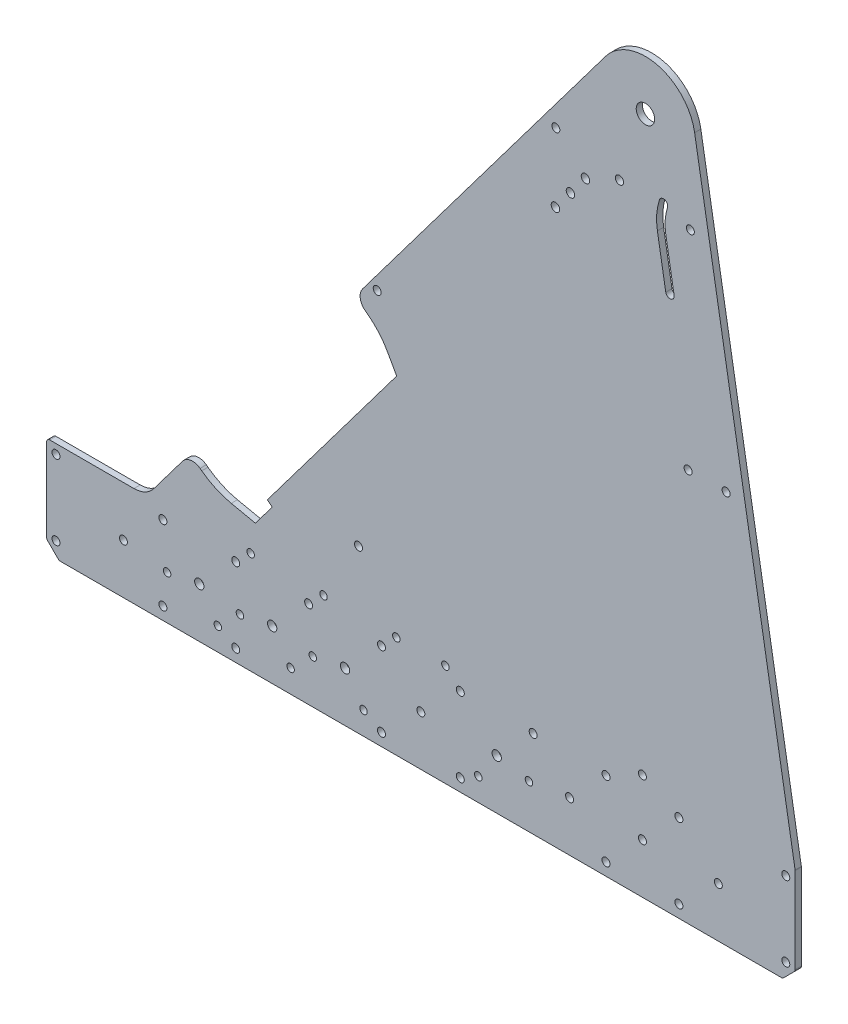
from build123d import *

# Parameters (mm, degrees)
BOSS_EXTRUDE1_DEPTH = 3.175
CUT_EXTRUDE1_REACH  = 534.132
SKETCH2_R           = 2.032
SKETCH5_R           = 2.032
SKETCH5_R_2         = 2.38125
CUT_EXTRUDE4_DEPTH  = 533.132273265
SKETCH6_R           = 2.032
CUT_EXTRUDE5_DEPTH  = 533.132273265
SKETCH3_R           = 4.699
SKETCH3_R_2         = 2.032
SKETCH3_R_3         = 2.0955
SKETCH3_R_4         = 2.159
CUT_EXTRUDE2_DEPTH  = 533.132273265
FILLET1_R           = 1.5875
CUT_EXTRUDE3_REACH  = 534.132
SKETCH4_R           = 1.905
FILLET2_R           = 38.1
FILLET3_R           = 6.35


with BuildPart() as part:
    # Sketch1 → Boss-Extrude1 (new body)
    with BuildSketch(Plane.XY):
        with BuildLine():
            Line((0, 0), (381, 0))
            Line((381, 0), (381, 50.8))
            Line((381, 50.8), (329.837432577, 350.351326687))
            ThreePointArc((329.837432577, 350.351326687), (310.787920632, 370.759100277), (284.504927721, 361.348180455))
            Line((284.504927721, 361.348180455), (157.027492501, 191.955579526))
            Line((157.027492501, 191.955579526), (169.711912675, 182.409841741))
            Line((169.711912675, 182.409841741), (178.167615548, 167.244965001))
            Line((178.167615548, 167.244965001), (112.326505112, 79.754995301))
            Line((112.326505112, 79.754995301), (114.863389147, 77.845847744))
            Line((114.863389147, 77.845847744), (106.272225141, 66.429869588))
            Line((106.272225141, 66.429869588), (85.709420174, 70.786944209))
            Line((85.709420174, 70.786944209), (73.025, 80.332681993))
            Line((73.025, 80.332681993), (54.610499914, 55.863409773))
            ThreePointArc((54.610499914, 55.863409773), (50.133294634, 52.136138511), (44.462963775, 50.8))
            Line((44.462963775, 50.8), (0, 50.8))
            Line((0, 50.8), (0, 0))
        make_face()
    extrude(amount=BOSS_EXTRUDE1_DEPTH)

    # Sketch2 → Cut-Extrude1 (cut, up to next)
    with BuildSketch(Plane.XY.offset(3.175), mode=Mode.PRIVATE) as cut_extrude1_sk1:
        with Locations((4.7625, 46.0375)):
            Circle(SKETCH2_R)
    cut_extrude1_tool1 = extrude(cut_extrude1_sk1.sketch, amount=-CUT_EXTRUDE1_REACH, mode=Mode.PRIVATE) & part.part
    # Sketch2 → Cut-Extrude1 (cut, up to next)
    with BuildSketch(Plane.XY.offset(3.175), mode=Mode.PRIVATE) as cut_extrude1_sk2:
        with Locations((4.7625, 7.9375)):
            Circle(SKETCH2_R)
    cut_extrude1_tool2 = extrude(cut_extrude1_sk2.sketch, amount=-CUT_EXTRUDE1_REACH, mode=Mode.PRIVATE) & part.part
    # Sketch2 → Cut-Extrude1 (cut, up to next)
    with BuildSketch(Plane.XY.offset(3.175), mode=Mode.PRIVATE) as cut_extrude1_sk3:
        with Locations((376.2375, 7.9375)):
            Circle(SKETCH2_R)
    cut_extrude1_tool3 = extrude(cut_extrude1_sk3.sketch, amount=-CUT_EXTRUDE1_REACH, mode=Mode.PRIVATE) & part.part
    # Sketch2 → Cut-Extrude1 (cut, up to next)
    with BuildSketch(Plane.XY.offset(3.175), mode=Mode.PRIVATE) as cut_extrude1_sk4:
        with Locations((376.2375, 46.0375)):
            Circle(SKETCH2_R)
    cut_extrude1_tool4 = extrude(cut_extrude1_sk4.sketch, amount=-CUT_EXTRUDE1_REACH, mode=Mode.PRIVATE) & part.part
    # Sketch2 → Cut-Extrude1 (cut, up to next)
    with BuildSketch(Plane.XY.offset(3.175), mode=Mode.PRIVATE) as cut_extrude1_sk5:
        Polygon((0, 6.35), (0, 0), (6.35, 0), align=None)
    cut_extrude1_tool5 = extrude(cut_extrude1_sk5.sketch, amount=-CUT_EXTRUDE1_REACH, mode=Mode.PRIVATE) & part.part
    # Sketch2 → Cut-Extrude1 (cut, up to next)
    with BuildSketch(Plane.XY.offset(3.175), mode=Mode.PRIVATE) as cut_extrude1_sk6:
        Polygon((381, 0), (374.65, 0), (381, 6.35), align=None)
    cut_extrude1_tool6 = extrude(cut_extrude1_sk6.sketch, amount=-CUT_EXTRUDE1_REACH, mode=Mode.PRIVATE) & part.part
    add(cut_extrude1_tool1.solids().sort_by_distance((4.7625, 46.0375, 3.175))[0], mode=Mode.SUBTRACT)
    add(cut_extrude1_tool2.solids().sort_by_distance((4.7625, 7.9375, 3.175))[0], mode=Mode.SUBTRACT)
    add(cut_extrude1_tool3.solids().sort_by_distance((376.2375, 7.9375, 3.175))[0], mode=Mode.SUBTRACT)
    add(cut_extrude1_tool4.solids().sort_by_distance((376.2375, 46.0375, 3.175))[0], mode=Mode.SUBTRACT)
    add(cut_extrude1_tool5.solids().sort_by_distance((2.116667, 2.116667, 3.175))[0], mode=Mode.SUBTRACT)
    add(cut_extrude1_tool6.solids().sort_by_distance((378.883333, 2.116667, 3.175))[0], mode=Mode.SUBTRACT)

    # Sketch5 → Cut-Extrude4 (cut, through all)
    with BuildSketch(Plane.XY.offset(3.175)):
        with Locations((39.116, 25.4)):
            Circle(SKETCH5_R)
        with Locations((59.182, 6.35)):
            Circle(SKETCH5_R)
        with Locations((59.182, 44.45)):
            Circle(SKETCH5_R)
        with Locations((96.266, 44.45)):
            Circle(SKETCH5_R)
        with Locations((133.35, 44.45)):
            Circle(SKETCH5_R)
        with Locations((170.434, 44.45)):
            Circle(SKETCH5_R)
        with Locations((210.566, 44.45)):
            Circle(SKETCH5_R)
        with Locations((210.566, 6.35)):
            Circle(SKETCH5_R)
        with Locations((170.434, 6.35)):
            Circle(SKETCH5_R)
        with Locations((247.65, 44.45)):
            Circle(SKETCH5_R)
        with Locations((266.192, 25.4)):
            Circle(SKETCH5_R)
        with Locations((77.724, 25.4)):
            Circle(SKETCH5_R_2)
        with Locations((114.808, 25.4)):
            Circle(SKETCH5_R_2)
        with Locations((151.892, 25.4)):
            Circle(SKETCH5_R_2)
        with Locations((229.108, 25.4)):
            Circle(SKETCH5_R_2)
        with Locations((190.5, 25.4)):
            Circle(SKETCH5_R)
        with Locations((303.276, 25.4)):
            Circle(SKETCH5_R)
        with Locations((341.884, 25.4)):
            Circle(SKETCH5_R)
    extrude(amount=-CUT_EXTRUDE4_DEPTH, mode=Mode.SUBTRACT)

    # Sketch6 → Cut-Extrude5 (cut, through all)
    with BuildSketch(Plane.XY.offset(3.175)):
        with Locations((284.734, 44.45)):
            Circle(SKETCH6_R)
        with Locations((284.734, 6.35)):
            Circle(SKETCH6_R)
        with Locations((321.818, 6.35)):
            Circle(SKETCH6_R)
        with Locations((321.818, 44.45)):
            Circle(SKETCH6_R)
        with Locations((96.266, 6.35)):
            Circle(SKETCH6_R)
        with Locations((303.276, 53.975)):
            Circle(SKETCH6_R)
    extrude(amount=-CUT_EXTRUDE5_DEPTH, mode=Mode.SUBTRACT)

    # Sketch3 → Cut-Extrude2 (cut, through all)
    with BuildSketch(Plane.XY.offset(3.175)):
        with Locations((304.8, 346.075)):
            Circle(SKETCH3_R)
        with Locations((168.275, 200.025)):
            Circle(SKETCH3_R_2)
        with Locations((158.75, 82.55)):
            Circle(SKETCH3_R_2)
        with Locations((291.577036885, 310.343175999)):
            Circle(SKETCH3_R_3)
        with Locations((274.268905915, 302.385091914)):
            Circle(SKETCH3_R_4)
        with Locations((266.632315687, 292.237555774)):
            Circle(SKETCH3_R_4)
        with Locations((258.99572546, 282.090019635)):
            Circle(SKETCH3_R_4)
        with Locations((327.675448038, 306.434088454)):
            Circle(SKETCH3_R_2)
        with Locations((345.849836456, 200.025)):
            Circle(SKETCH3_R_2)
        with Locations((259.211844923, 317.178274551)):
            Circle(SKETCH3_R_2)
        with Locations((326.523973131, 200.025)):
            Circle(SKETCH3_R_2)
        with BuildLine():
            Line((315.144293407, 272.686512232), (310.890297079, 297.59320296))
            ThreePointArc((310.890297079, 297.59320296), (310.545694803, 304.77018059), (311.933694664, 311.820089456))
            ThreePointArc((311.933694664, 311.820089456), (314.6561635, 313.20237938), (316.038453425, 310.479910544))
            ThreePointArc((316.038453425, 310.479910544), (314.852128757, 304.454347411), (315.146660617, 298.320178497))
            Line((315.146660617, 298.320178497), (319.400656945, 273.413487768))
            ThreePointArc((319.400656945, 273.413487768), (317.635962944, 270.921818231), (315.144293407, 272.686512232))
        make_face()
    extrude(amount=-CUT_EXTRUDE2_DEPTH, mode=Mode.SUBTRACT)

    # Fillet1
    fillet1_edges = [part.edges().sort_by_distance(p)[0] for p in [
        (374.65, 0, 1.5875),
        (381, 6.35, 1.5875),
        (381, 50.8, 1.5875),
        (6.35, 0, 1.5875),
        (0, 6.35, 1.5875),
        (0, 50.8, 1.5875),
    ]]
    fillet(fillet1_edges, radius=FILLET1_R)

    # Sketch4 → Cut-Extrude3 (cut, up to next)
    with BuildSketch(Plane(origin=(0, 0, 0), x_dir=(-1, 0, 0), z_dir=(0, 0, -1)), mode=Mode.PRIVATE) as cut_extrude3_sk1:
        with Locations((-61.318145625, 22.298133105)):
            Circle(SKETCH4_R)
    cut_extrude3_tool1 = extrude(cut_extrude3_sk1.sketch, amount=-CUT_EXTRUDE3_REACH, mode=Mode.PRIVATE) & part.part
    # Sketch4 → Cut-Extrude3 (cut, up to next)
    with BuildSketch(Plane(origin=(0, 0, 0), x_dir=(-1, 0, 0), z_dir=(0, 0, -1)), mode=Mode.PRIVATE) as cut_extrude3_sk2:
        with Locations((-87.131339764, 11.605958005)):
            Circle(SKETCH4_R)
    cut_extrude3_tool2 = extrude(cut_extrude3_sk2.sketch, amount=-CUT_EXTRUDE3_REACH, mode=Mode.PRIVATE) & part.part
    # Sketch4 → Cut-Extrude3 (cut, up to next)
    with BuildSketch(Plane(origin=(0, 0, 0), x_dir=(-1, 0, 0), z_dir=(0, 0, -1)), mode=Mode.PRIVATE) as cut_extrude3_sk3:
        with Locations((-98.402145625, 22.298133105)):
            Circle(SKETCH4_R)
    cut_extrude3_tool3 = extrude(cut_extrude3_sk3.sketch, amount=-CUT_EXTRUDE3_REACH, mode=Mode.PRIVATE) & part.part
    # Sketch4 → Cut-Extrude3 (cut, up to next)
    with BuildSketch(Plane(origin=(0, 0, 0), x_dir=(-1, 0, 0), z_dir=(0, 0, -1)), mode=Mode.PRIVATE) as cut_extrude3_sk4:
        with Locations((-124.215339764, 11.605958005)):
            Circle(SKETCH4_R)
    cut_extrude3_tool4 = extrude(cut_extrude3_sk4.sketch, amount=-CUT_EXTRUDE3_REACH, mode=Mode.PRIVATE) & part.part
    # Sketch4 → Cut-Extrude3 (cut, up to next)
    with BuildSketch(Plane(origin=(0, 0, 0), x_dir=(-1, 0, 0), z_dir=(0, 0, -1)), mode=Mode.PRIVATE) as cut_extrude3_sk5:
        with Locations((-135.486145625, 22.298133105)):
            Circle(SKETCH4_R)
    cut_extrude3_tool5 = extrude(cut_extrude3_sk5.sketch, amount=-CUT_EXTRUDE3_REACH, mode=Mode.PRIVATE) & part.part
    # Sketch4 → Cut-Extrude3 (cut, up to next)
    with BuildSketch(Plane(origin=(0, 0, 0), x_dir=(-1, 0, 0), z_dir=(0, 0, -1)), mode=Mode.PRIVATE) as cut_extrude3_sk6:
        with Locations((-161.299339764, 11.605958005)):
            Circle(SKETCH4_R)
    cut_extrude3_tool6 = extrude(cut_extrude3_sk6.sketch, amount=-CUT_EXTRUDE3_REACH, mode=Mode.PRIVATE) & part.part
    # Sketch4 → Cut-Extrude3 (cut, up to next)
    with BuildSketch(Plane(origin=(0, 0, 0), x_dir=(-1, 0, 0), z_dir=(0, 0, -1)), mode=Mode.PRIVATE) as cut_extrude3_sk7:
        with Locations((-245.513854375, 22.298133105)):
            Circle(SKETCH4_R)
    cut_extrude3_tool7 = extrude(cut_extrude3_sk7.sketch, amount=-CUT_EXTRUDE3_REACH, mode=Mode.PRIVATE) & part.part
    # Sketch4 → Cut-Extrude3 (cut, up to next)
    with BuildSketch(Plane(origin=(0, 0, 0), x_dir=(-1, 0, 0), z_dir=(0, 0, -1)), mode=Mode.PRIVATE) as cut_extrude3_sk8:
        with Locations((-219.700660236, 11.605958005)):
            Circle(SKETCH4_R)
    cut_extrude3_tool8 = extrude(cut_extrude3_sk8.sketch, amount=-CUT_EXTRUDE3_REACH, mode=Mode.PRIVATE) & part.part
    # Sketch4 → Cut-Extrude3 (cut, up to next)
    with BuildSketch(Plane(origin=(0, 0, 0), x_dir=(-1, 0, 0), z_dir=(0, 0, -1)), mode=Mode.PRIVATE) as cut_extrude3_sk9:
        with Locations((-202.981986443, 51.968407021)):
            Circle(SKETCH4_R)
    cut_extrude3_tool9 = extrude(cut_extrude3_sk9.sketch, amount=-CUT_EXTRUDE3_REACH, mode=Mode.PRIVATE) & part.part
    # Sketch4 → Cut-Extrude3 (cut, up to next)
    with BuildSketch(Plane(origin=(0, 0, 0), x_dir=(-1, 0, 0), z_dir=(0, 0, -1)), mode=Mode.PRIVATE) as cut_extrude3_sk10:
        with Locations((-178.018013557, 51.968407021)):
            Circle(SKETCH4_R)
    cut_extrude3_tool10 = extrude(cut_extrude3_sk10.sketch, amount=-CUT_EXTRUDE3_REACH, mode=Mode.PRIVATE) & part.part
    # Sketch4 → Cut-Extrude3 (cut, up to next)
    with BuildSketch(Plane(origin=(0, 0, 0), x_dir=(-1, 0, 0), z_dir=(0, 0, -1)), mode=Mode.PRIVATE) as cut_extrude3_sk11:
        with Locations((-140.934013557, 51.968407021)):
            Circle(SKETCH4_R)
    cut_extrude3_tool11 = extrude(cut_extrude3_sk11.sketch, amount=-CUT_EXTRUDE3_REACH, mode=Mode.PRIVATE) & part.part
    # Sketch4 → Cut-Extrude3 (cut, up to next)
    with BuildSketch(Plane(origin=(0, 0, 0), x_dir=(-1, 0, 0), z_dir=(0, 0, -1)), mode=Mode.PRIVATE) as cut_extrude3_sk12:
        with Locations((-103.850013557, 51.968407021)):
            Circle(SKETCH4_R)
    cut_extrude3_tool12 = extrude(cut_extrude3_sk12.sketch, amount=-CUT_EXTRUDE3_REACH, mode=Mode.PRIVATE) & part.part
    add(cut_extrude3_tool1.solids().sort_by_distance((61.318146, 22.298133, 0))[0], mode=Mode.SUBTRACT)
    add(cut_extrude3_tool2.solids().sort_by_distance((87.13134, 11.605958, 0))[0], mode=Mode.SUBTRACT)
    add(cut_extrude3_tool3.solids().sort_by_distance((98.402146, 22.298133, 0))[0], mode=Mode.SUBTRACT)
    add(cut_extrude3_tool4.solids().sort_by_distance((124.21534, 11.605958, 0))[0], mode=Mode.SUBTRACT)
    add(cut_extrude3_tool5.solids().sort_by_distance((135.486146, 22.298133, 0))[0], mode=Mode.SUBTRACT)
    add(cut_extrude3_tool6.solids().sort_by_distance((161.29934, 11.605958, 0))[0], mode=Mode.SUBTRACT)
    add(cut_extrude3_tool7.solids().sort_by_distance((245.513854, 22.298133, 0))[0], mode=Mode.SUBTRACT)
    add(cut_extrude3_tool8.solids().sort_by_distance((219.70066, 11.605958, 0))[0], mode=Mode.SUBTRACT)
    add(cut_extrude3_tool9.solids().sort_by_distance((202.981986, 51.968407, 0))[0], mode=Mode.SUBTRACT)
    add(cut_extrude3_tool10.solids().sort_by_distance((178.018014, 51.968407, 0))[0], mode=Mode.SUBTRACT)
    add(cut_extrude3_tool11.solids().sort_by_distance((140.934014, 51.968407, 0))[0], mode=Mode.SUBTRACT)
    add(cut_extrude3_tool12.solids().sort_by_distance((103.850014, 51.968407, 0))[0], mode=Mode.SUBTRACT)

    # Fillet2
    fillet2_edges = [part.edges().sort_by_distance(p)[0] for p in [
        (85.709420174, 70.786944209, 1.5875),
        (169.711912675, 182.409841741, 1.5875),
    ]]
    fillet(fillet2_edges, radius=FILLET2_R)

    # Fillet3
    fillet3_edges = [part.edges().sort_by_distance(p)[0] for p in [
        (73.025, 80.332681993, 1.5875),
        (157.027492501, 191.955579526, 1.5875),
    ]]
    fillet(fillet3_edges, radius=FILLET3_R)


solid = part.part
